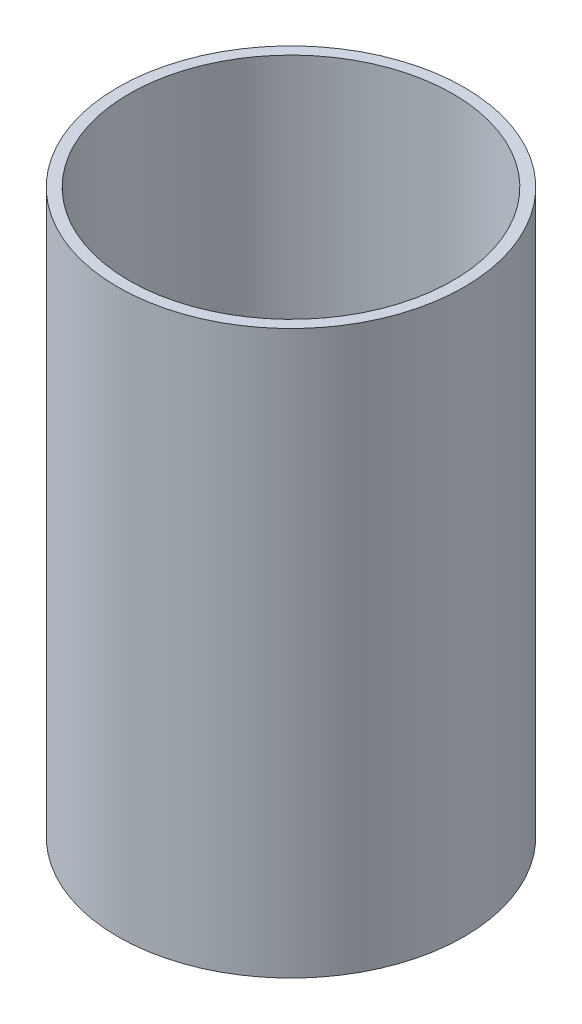
from build123d import *

# Parameters (mm, degrees)
SKETCH1_R           = 25.4
SKETCH1_R_2         = 23.749
BOSS_EXTRUDE1_DEPTH = 82.55


with BuildPart() as part:
    # Sketch1 → Boss-Extrude1 (new body)
    with BuildSketch(Plane(origin=(0, 0, 0), x_dir=(1, 0, 0), z_dir=(0, 1, 0))):
        Circle(SKETCH1_R)
        Circle(SKETCH1_R_2, mode=Mode.SUBTRACT)
    extrude(amount=BOSS_EXTRUDE1_DEPTH)


solid = part.part
